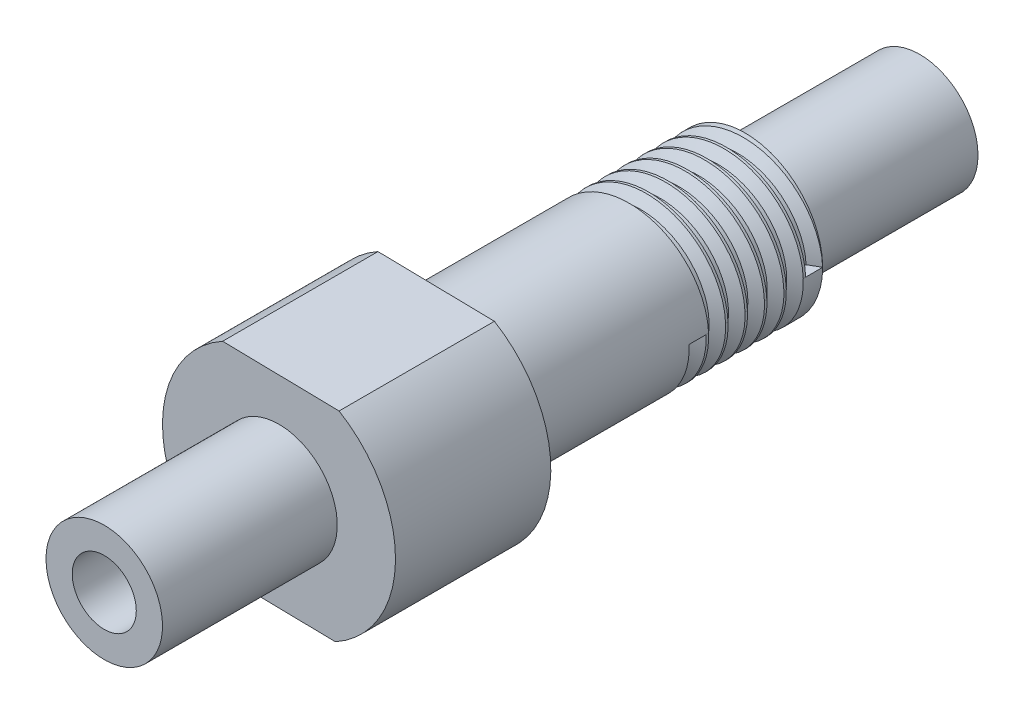
from build123d import *

# Parameters (mm, degrees)
SKETCH1_R                 = 4
BOSS_EXTRUDE1_DEPTH       = 16
SKETCH2_R                 = 6
BOSS_EXTRUDE2_DEPTH       = 8
SKETCH3_R                 = 3
BOSS_EXTRUDE3_DEPTH       = 9
BOSS_EXTRUDE4_START       = 9
SKETCH8_R                 = 3
BOSS_EXTRUDE4_DEPTH       = 9
M4X0_7_TAPPED_HOLE2_D     = 3.3
M4X0_7_TAPPED_HOLE2_DEPTH = 10
M4X0_7_TAPPED_HOLE2_TIP   = 0.991420021
THREAD1_PITCH             = 1
M4X0_7_TAPPED_HOLE3_D     = 3.3
M4X0_7_TAPPED_HOLE3_DEPTH = 10
M4X0_7_TAPPED_HOLE3_TIP   = 0.991420021
CUT_EXTRUDE1_START        = -10
CUT_EXTRUDE1_DEPTH        = 10


with BuildPart() as part:
    # Sketch1 → Boss-Extrude1 (new body)
    with BuildSketch(Plane.XY):
        Circle(SKETCH1_R)
    extrude(amount=BOSS_EXTRUDE1_DEPTH)

    # Sketch2 → Boss-Extrude2 (add)
    with BuildSketch(Plane.XY.offset(16)):
        Circle(SKETCH2_R)
    extrude(amount=BOSS_EXTRUDE2_DEPTH)

    # Sketch3 → Boss-Extrude3 (add)
    with BuildSketch(Plane(origin=(0, 0, 0), x_dir=(-1, 0, 0), z_dir=(0, 0, -1))):
        Circle(SKETCH3_R)
    extrude(amount=BOSS_EXTRUDE3_DEPTH)

    # Sketch8 → Boss-Extrude4 (add)
    with BuildSketch(Plane.XY.offset(24).offset(BOSS_EXTRUDE4_START)):
        with Locations(Location((0, 0, 0), (0, 0, 180))):
            Circle(SKETCH8_R)
    extrude(amount=-BOSS_EXTRUDE4_DEPTH)

    # M4x0.7 Tapped Hole2
    with Locations(Plane.XY.offset(33)):
        with Locations((0, 0)):
            Hole(M4X0_7_TAPPED_HOLE2_D / 2, depth=M4X0_7_TAPPED_HOLE2_DEPTH)
            with Locations((0, 0, -(M4X0_7_TAPPED_HOLE2_DEPTH + M4X0_7_TAPPED_HOLE2_TIP / 2))):  # 118° drill point
                Cone(0, M4X0_7_TAPPED_HOLE2_D / 2, M4X0_7_TAPPED_HOLE2_TIP, mode=Mode.SUBTRACT)

    # Thread1: the profile of Thread Profile2 profile screwed along a right-hand helix of 6 turns, 8 arcs to a turn; built about Z, then put on its axis
    thread1_z = Axis((0, 0, 0), (0, 0, 1))
    thread1_corners = [(4.0003, 0, -0.000173205), (4.0003, 0, 0.875173202), (3.458734125, 0, 0.562499999), (3.458734125, 0, 0.312499999)]
    with BuildLine(mode=Mode.PRIVATE) as thread1_profile:
        Line(thread1_corners[0], thread1_corners[1])
        Line(thread1_corners[1], thread1_corners[2])
        Line(thread1_corners[2], thread1_corners[3])
        Line(thread1_corners[3], thread1_corners[0])
    thread1_cap = Face(thread1_profile.wire())
    thread1_turn_angles = [0, 22.5, 45, 67.5, 90, 112.5, 135, 157.5, 180, 202.5, 225, 247.5, 270, 292.5, 315, 337.5, 360]
    thread1_turn_weights = [1, 0.9238795325112867, 1, 0.9238795325112867, 1, 0.9238795325112867, 1, 0.9238795325112867, 1, 0.9238795325112867, 1, 0.9238795325112867, 1, 0.9238795325112867, 1, 0.9238795325112867, 1]
    thread1_turn_rails = [Edge.make_bspline([Vector(p[0], p[1], 0).rotate(thread1_z, thread1_turn_angles[k]) / thread1_turn_weights[k] + Vector(0, 0, p[2] + THREAD1_PITCH * thread1_turn_angles[k] / 360) for k in range(17)], [0, 0, 0, 1, 1, 2, 2, 3, 3, 4, 4, 5, 5, 6, 6, 7, 7, 8, 8, 8], 2, thread1_turn_weights) for p in thread1_corners]
    thread1_turn_sides = [Face.make_surface_from_curves(thread1_turn_rails[p[0]], thread1_turn_rails[p[1]]) for p in [(0, 1), (1, 2), (2, 3), (3, 0)]]
    thread1 = Plane(origin=(0, 0, 0), x_dir=(1, 0, 0), z_dir=(0, 0, 1)) * Solid(Shell([*[p.moved(Location((0, 0, THREAD1_PITCH * i))) for i in range(6) for p in thread1_turn_sides], thread1_cap, thread1_cap.rotate(thread1_z, 2160).moved(Location((0, 0, THREAD1_PITCH * 2160 / 360)))]))
    add(thread1, mode=Mode.SUBTRACT)

    # M4x0.7 Tapped Hole3
    with Locations(Plane(origin=(0, 0, -9), x_dir=(-1, 0, 0), z_dir=(0, 0, -1))):
        with Locations((0, 0)):
            Hole(M4X0_7_TAPPED_HOLE3_D / 2, depth=M4X0_7_TAPPED_HOLE3_DEPTH)
            with Locations((0, 0, -(M4X0_7_TAPPED_HOLE3_DEPTH + M4X0_7_TAPPED_HOLE3_TIP / 2))):  # 118° drill point
                Cone(0, M4X0_7_TAPPED_HOLE3_D / 2, M4X0_7_TAPPED_HOLE3_TIP, mode=Mode.SUBTRACT)

    # Sketch36 → Cut-Extrude1 (cut)
    with BuildSketch(Plane.XY.offset(24).offset(CUT_EXTRUDE1_START)):
        with BuildLine():
            Line((-2.90430853, 5.250237325), (3.094684634, 5.140323629))
            ThreePointArc((3.094684634, 5.140323629), (0.109913695, 5.998993164), (-2.90430853, 5.250237325))
        make_face()
        with BuildLine():
            ThreePointArc((-3.094684634, -5.140323629), (-0.109913695, -5.998993164), (2.90430853, -5.250237325))
            Line((2.90430853, -5.250237325), (-3.094684634, -5.140323629))
        make_face()
    extrude(amount=CUT_EXTRUDE1_DEPTH, mode=Mode.SUBTRACT)


solid = part.part
